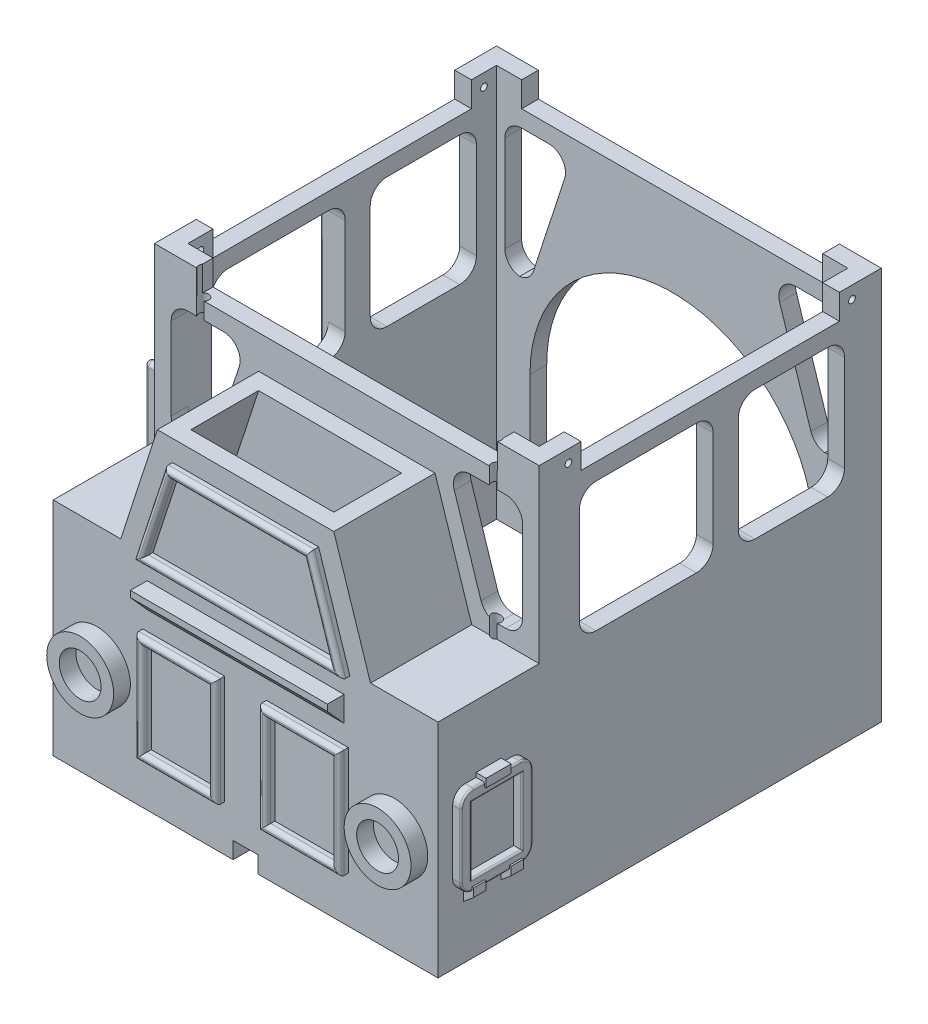
from build123d import *
from build123d.topology import SkipClean

# Parameters (mm, degrees)
SKETCH_4_W               = 46
SKETCH_4_H               = 53
SKETCH_4_W_2             = 42
SKETCH_4_H_2             = 49
EXTRUDE_1_DEPTH          = 26.5
SKETCH_5_W               = 2
SKETCH_5_H               = 2.4
SKETCH_5_H_2             = 3
SKETCH_5_H_3             = 4.8
EXTRUDE_2_DEPTH          = 17.5
SKETCH_6_W               = 12.1
SKETCH_6_H               = 2
EXTRUDE_3_DEPTH          = 44
SKETCH_8_W               = 2
SKETCH_8_H               = 2
SKETCH_8_W_2             = 41
SKETCH_8_W_3             = 1
SKETCH_8_H_2             = 34.5
SKETCH_8_H_3             = 2.4
SKETCH_8_H_4             = 36.9
SKETCH_8_W_4             = 42
EXTRUDE_4_DEPTH          = 2
EXTRUDE_9_DEPTH          = 2
EXTRUDE_10_DEPTH         = 12.1
EXTRUDE_11_DEPTH         = 2
SKETCH_12_W              = 9.778944
SKETCH_12_H              = 13
SKETCH_12_W_2            = 7.778944
SKETCH_12_H_2            = 11
EXTRUDE_1_2_DEPTH        = 1
FILLET_1_R               = 0.5
SKETCH_12_3_R            = 4
SKETCH_12_3_R_2          = 2.5
EXTRUDE_12_DEPTH         = 2
SKETCH_12_4_W            = 23.557888
SKETCH_12_4_H            = 3
EXTRUDE_13_DEPTH         = 2
CUT_EXTRUDE_1_DEPTH      = 63.911247
CUT_EXTRUDE_1_DEPTH_BACK = 63.911247
EXTRUDE_START            = -12.1
EXTRUDE_14_DEPTH         = 2
EXTRUDE_15_DEPTH         = 2
FILLET_2_R               = 2
SKETCH_17_R              = 17
CUT_EXTRUDE_2_DEPTH      = 2
EXTRUDE_2_2_DEPTH        = 1
FILLET_3_R               = 0.3
SKETCH_19_W              = 1
SKETCH_19_H              = 19.5
EXTRUDE_3_2_DEPTH        = 2
SKETCH_19_3_W            = 1
SKETCH_19_3_H            = 29.5
EXTRUDE_4_2_DEPTH        = 2
FILLET_4_R               = 0.5
FILLET_5_R               = 0.5
SKETCH_20_W              = 8.6
SKETCH_20_H              = 10.6
SKETCH_20_W_2            = 6
SKETCH_20_H_2            = 8
EXTRUDE_16_DEPTH         = 1
EXTRUDE_START_2          = -46
SKETCH_20_4_W            = 8.6
SKETCH_20_4_H            = 10.6
SKETCH_20_4_W_2          = 6
SKETCH_20_4_H_2          = 8
EXTRUDE_18_DEPTH         = 1
FILLET_6_R               = 1.5
SKETCH_20_3_W            = 3
SKETCH_20_3_H            = 1
SKETCH_20_3_W_2          = 1.5
SKETCH_20_3_H_2          = 2
EXTRUDE_17_DEPTH         = 1.2
SKETCH_20_5_W            = 3
SKETCH_20_5_H            = 1
SKETCH_20_5_W_2          = 1.5
SKETCH_20_5_H_2          = 2
EXTRUDE_19_DEPTH         = 1.2
CUT_EXTRUDE_3_DEPTH      = 68.026879
FILLET_7_R               = 0.2
SKETCH_22_W              = 2
SKETCH_22_H              = 2
SKETCH_22_W_2            = 3
SKETCH_22_H_2            = 3
EXTRUDE_20_DEPTH         = 3
SKETCH_23_R              = 0.4
CUT_EXTRUDE_4_DEPTH      = 73.450604
SKETCH_24_W              = 8
SKETCH_24_H              = 5
EXTRUDE_21_DEPTH         = 2
SKETCH_25_R              = 0.6
CUT_EXTRUDE_5_DEPTH      = 61.384187
SKETCH_26_W              = 3
SKETCH_26_H              = 2
CUT_EXTRUDE_6_DEPTH      = 2


# Some blends are built 0.0001 mm under size
with BuildPart() as part:
    # 草图4 → Extrude 1 (new body)
    with BuildSketch(Plane(origin=(0, 0, 0), x_dir=(1, 0, 0), z_dir=(0, 1, 0))):
        Rectangle(SKETCH_4_W, SKETCH_4_H)
        Rectangle(SKETCH_4_W_2, SKETCH_4_H_2, mode=Mode.SUBTRACT)
    extrude(amount=EXTRUDE_1_DEPTH)

    # 草图5 → Extrude 2 (add)
    with BuildSketch(Plane(origin=(0, 26.5, 0), x_dir=(1, 0, 0), z_dir=(0, 1, 0))):
        Polygon((-20, 26.5), (-23, 26.5), (-23, 24.5), (-21, 24.5), (-20, 24.5), align=None)
        with Locations((-22, 23.3)):
            Rectangle(SKETCH_5_W, SKETCH_5_H)
        with Locations((-22, 7.9)):
            Rectangle(SKETCH_5_W, SKETCH_5_H_2)
        with Locations((-22, -12)):
            Rectangle(SKETCH_5_W, SKETCH_5_H_3)
        with Locations((22, -12)):
            Rectangle(SKETCH_5_W, SKETCH_5_H_3)
        with Locations((22, 7.9)):
            Rectangle(SKETCH_5_W, SKETCH_5_H_2)
        with Locations((22, 23.3)):
            Rectangle(SKETCH_5_W, SKETCH_5_H)
        Polygon((23, 26.5), (20, 26.5), (20, 24.5), (21, 24.5), (23, 24.5), align=None)
    extrude(amount=EXTRUDE_2_DEPTH)

    # 草图6 → Extrude 3 (add)
    with BuildSketch(Plane.ZY.offset(23)):
        with Locations((20.45, 25.5)):
            Rectangle(SKETCH_6_W, SKETCH_6_H)
    extrude(amount=-EXTRUDE_3_DEPTH)

    # 草图8 → Extrude 4 (add)
    with BuildSketch(Plane(origin=(0, 44, 0), x_dir=(1, 0, 0), z_dir=(0, 1, 0))):
        with Locations((-22, 25.5)):
            Rectangle(SKETCH_8_W, SKETCH_8_H)
        with Locations((0.5, 25.5)):
            Rectangle(SKETCH_8_W_2, SKETCH_8_H)
        with Locations((-20.5, 25.5)):
            Rectangle(SKETCH_8_W_3, SKETCH_8_H)
        with Locations((-22, 4.85)):
            Rectangle(SKETCH_8_W, SKETCH_8_H_2)
        with Locations((-22, 23.3)):
            Rectangle(SKETCH_8_W, SKETCH_8_H_3)
        with Locations((22, 25.5)):
            Rectangle(SKETCH_8_W, SKETCH_8_H)
        with Locations((22, 6.05)):
            Rectangle(SKETCH_8_W, SKETCH_8_H_4)
        with Locations((22, -13.4)):
            Rectangle(SKETCH_8_W, SKETCH_8_H)
        with Locations((0, -13.4)):
            Rectangle(SKETCH_8_W_4, SKETCH_8_H)
        with Locations((-22, -13.4)):
            Rectangle(SKETCH_8_W, SKETCH_8_H)
    extrude(amount=-EXTRUDE_4_DEPTH)

    # 草图9 → 凸台-拉伸9 (add)
    with BuildSketch(Plane.XY.offset(14.4)):
        Polygon((12, 42), (-12, 42), (-16.5, 28.150424), (-21, 28.150424), (-21, 26.5), (-21, 24.5), (21, 24.5), (21, 26.5), (21, 28.150424), (16.5, 28.150424), align=None)
    extrude(amount=-EXTRUDE_9_DEPTH)

    # 草图10 → 凸台-拉伸10 (add)
    with BuildSketch(Plane.XY.offset(14.4)):
        Polygon((-8.546915, 40), (-10.546915, 40), (-14.933331, 26.5), (-12.933331, 26.5), align=None)
        Polygon((8.546915, 40), (10.546915, 40), (14.933331, 26.5), (12.933331, 26.5), align=None)
    extrude(amount=EXTRUDE_10_DEPTH)

    # 草图11 → 凸台-拉伸11 (add)
    with BuildSketch(Plane.XY.offset(26.5)):
        Polygon((-10.546915, 40), (10.546915, 40), (14.933331, 26.5), (-14.933331, 26.5), align=None)
    extrude(amount=-EXTRUDE_11_DEPTH)

    # 草图12 → Extrude 1 2 (add)
    # profile 1 of 3: a face of its own
    with BuildSketch(Plane.XY.offset(26.5)):
        Polygon((-8.730559, 37.5), (8.730559, 37.5), (12.467135, 26), (-12.467135, 26), align=None)
        Polygon((-8.004016, 36.5), (8.004016, 36.5), (11.090753, 27), (-11.090753, 27), align=None, mode=Mode.SUBTRACT)
    # profile 2 of 3: a face of its own
    with BuildSketch(Plane.XY.offset(26.5)):
        with Locations((-7.389472, 12)):
            Rectangle(SKETCH_12_W, SKETCH_12_H)
        with Locations((-7.389472, 12)):
            Rectangle(SKETCH_12_W_2, SKETCH_12_H_2, mode=Mode.SUBTRACT)
    # profile 3 of 3: a face of its own
    with BuildSketch(Plane.XY.offset(26.5)):
        with Locations((7.389472, 12)):
            Rectangle(SKETCH_12_W, SKETCH_12_H)
        with Locations((7.389472, 12)):
            Rectangle(SKETCH_12_W_2, SKETCH_12_H_2, mode=Mode.SUBTRACT)
    extrude(amount=EXTRUDE_1_2_DEPTH)

    # 圆角1
    fillet_1_edges = [part.edges().sort_by_distance(p)[0] for p in [
        (-7.389472, 18.5, 27.5),
        (-2.5, 12, 27.5),
        (-7.389472, 17.5, 27.5),
        (-3.5, 12, 27.5),
        (-12.278944, 12, 27.5),
        (-7.389472, 5.5, 27.5),
        (-11.278944, 12, 27.5),
        (-7.389472, 6.5, 27.5),
        (0, 26, 27.5),
        (10.598847, 31.75, 27.5),
        (0, 37.5, 27.5),
        (-10.598847, 31.75, 27.5),
        (9.547385, 31.75, 27.5),
        (0, 27, 27.5),
        (-9.547385, 31.75, 27.5),
        (0, 36.5, 27.5),
        (2.5, 12, 27.5),
        (7.389472, 5.5, 27.5),
        (7.389472, 17.5, 27.5),
        (11.278944, 12, 27.5),
        (12.278944, 12, 27.5),
        (7.389472, 18.5, 27.5),
        (3.5, 12, 27.5),
        (7.389472, 6.5, 27.5),
    ]]
    fillet(fillet_1_edges, radius=FILLET_1_R - 0.0001)  # a hair under: the kernel refuses the full size

    # 草图12<3> → 凸台-拉伸12 (add)
    # profile 1 of 2: a face of its own
    with BuildSketch(Plane.XY.offset(26.5)):
        with Locations(Location((-17.778944, 12, 0), (0, 0, 180))):
            Circle(SKETCH_12_3_R)
        with Locations((-17.778944, 12)):
            Circle(SKETCH_12_3_R_2, mode=Mode.SUBTRACT)
    # profile 2 of 2: a face of its own
    with BuildSketch(Plane.XY.offset(26.5)):
        with Locations(Location((17.778944, 12, 0), (0, 0, 180))):
            Circle(SKETCH_12_3_R)
        with Locations((17.778944, 12)):
            Circle(SKETCH_12_3_R_2, mode=Mode.SUBTRACT)
    extrude(amount=EXTRUDE_12_DEPTH)

    # 草图12<4> → 凸台-拉伸13 (add)
    with BuildSketch(Plane.XY.offset(26.5)):
        with Locations((0, 22.25)):
            Rectangle(SKETCH_12_4_W, SKETCH_12_4_H)
    extrude(amount=EXTRUDE_13_DEPTH)

    # 草图13 → 切除-拉伸1 (cut, two sides: drawn at the far end of the back side and taken through both)
    with BuildSketch(Plane.ZY.offset(11.778944).offset(-CUT_EXTRUDE_1_DEPTH_BACK)):
        Polygon((28.5, 20.75), (28.5, 23), (26.5, 20.75), align=None)
    extrude(amount=CUT_EXTRUDE_1_DEPTH + CUT_EXTRUDE_1_DEPTH_BACK, mode=Mode.SUBTRACT)

    # 草图15 → 凸台-拉伸14 (add)
    with BuildSketch(Plane.XY.offset(26.5).offset(EXTRUDE_START)):
        Polygon((-10.546915, 40), (-14.933331, 26.5), (14.933331, 26.5), (10.546915, 40), align=None)
    extrude(amount=EXTRUDE_14_DEPTH)

    # 草图16 → 凸台-拉伸15 (add)
    with BuildSketch(Plane.XY.offset(-24.5)):
        Polygon((-11.350161, 44), (-17.036255, 26.5), (17.036255, 26.5), (11.350161, 44), align=None)
    extrude(amount=-EXTRUDE_15_DEPTH)

    # 圆角2
    # the kernel refuses this fillet: 2 mm, written as the material it adds along each edge
    with BuildSketch(Plane(origin=(20, 26.5, -26.5), x_dir=(0, 1, 0), z_dir=(0, 0, 1)), Plane(origin=(21, 42, 12.4), x_dir=(-1, 0, 0), z_dir=(0, 0, 1)), Plane(origin=(23, 42, 9.6), x_dir=(0, 0, -1), z_dir=(-1, 0, 0)), Plane(origin=(-23, 42, -22.1), x_dir=(0, 0, 1), z_dir=(1, 0, 0)), Plane(origin=(-23, 42, -6.4), x_dir=(0, 0, 1), z_dir=(1, 0, 0)), Plane(origin=(23, 42, -9.4), x_dir=(0, 0, -1), z_dir=(-1, 0, 0)), Plane(origin=(21, 28.150424, 14.4), x_dir=(-1, 0, 0), z_dir=(0, 0, -1)), Plane(origin=(-20, 26.5, -24.5), x_dir=(0, 1, 0), z_dir=(0, 0, -1))) as fillet_2_piece_1:
        with BuildLine():
            CenterArc((FILLET_2_R, FILLET_2_R), FILLET_2_R, 180, 90)
            Line((0, FILLET_2_R), (0, 0))
            Line((0, 0), (FILLET_2_R, 0))
        make_face()
    extrude(amount=2)
    with BuildSketch(Plane(origin=(21, 26.5, -22.1), x_dir=(0, 0, 1), z_dir=(1, 0, 0)), Plane(origin=(20, 42, -26.5), x_dir=(0, -1, 0), z_dir=(0, 0, 1)), Plane(origin=(-21, 42, 14.4), x_dir=(0, -1, 0), z_dir=(0, 0, -1)), Plane(origin=(-21, 42, 9.6), x_dir=(0, -1, 0), z_dir=(-1, 0, 0)), Plane(origin=(-20, 42, -24.5), x_dir=(0, -1, 0), z_dir=(0, 0, -1)), Plane(origin=(-21, 42, -9.4), x_dir=(0, -1, 0), z_dir=(-1, 0, 0)), Plane(origin=(21, 42, -6.4), x_dir=(0, -1, 0), z_dir=(1, 0, 0)), Plane(origin=(21, 42, -22.1), x_dir=(0, -1, 0), z_dir=(1, 0, 0)), Plane(origin=(-21, 28.150424, 14.4), x_dir=(1, 0, 0), z_dir=(0, 0, -1)), Plane(origin=(-23, 26.5, -22.1), x_dir=(0, 0, 1), z_dir=(1, 0, 0)), Plane(origin=(-23, 26.5, -6.4), x_dir=(0, 0, 1), z_dir=(1, 0, 0)), Plane(origin=(-21, 26.5, -9.4), x_dir=(0, 0, -1), z_dir=(-1, 0, 0)), Plane(origin=(-21, 26.5, 9.6), x_dir=(0, 0, -1), z_dir=(-1, 0, 0)), Plane(origin=(23, 26.5, 9.6), x_dir=(0, 0, -1), z_dir=(-1, 0, 0)), Plane(origin=(21, 26.5, -6.4), x_dir=(0, 0, 1), z_dir=(1, 0, 0)), Plane(origin=(23, 26.5, -9.4), x_dir=(0, 0, -1), z_dir=(-1, 0, 0))) as fillet_2_piece_2:
        with BuildLine():
            CenterArc((FILLET_2_R, -FILLET_2_R), FILLET_2_R, 90, 90)
            Line((0, -FILLET_2_R), (0, 0))
            Line((0, 0), (FILLET_2_R, 0))
        make_face()
    extrude(amount=2)
    with BuildSketch(Plane(origin=(-16.5, 28.150424, 14.4), x_dir=(0.30901699437494756, 0.9510565162951535, 0), z_dir=(0, 0, -1)), Plane(origin=(16.5, 28.150424, 14.4), x_dir=(1, 0, 0), z_dir=(0, 0, -1)), Plane(origin=(-17.036255, 26.5, -24.5), x_dir=(0.3090169943749497, 0.9510565162951528, 0), z_dir=(0, 0, -1)), Plane(origin=(17.036255, 26.5, -24.5), x_dir=(1, 0, 0), z_dir=(0, 0, -1))) as fillet_2_piece_3:
        with BuildLine():
            CenterArc((FILLET_2_R * 0.726542528005, -FILLET_2_R), FILLET_2_R, 90, 72)
            Line((-FILLET_2_R * 0.22451398829, -FILLET_2_R * 0.690983005625), (0, 0))
            Line((0, 0), (FILLET_2_R * 0.726542528005, 0))
        make_face()
    extrude(amount=2)
    with BuildSketch(Plane(origin=(-12, 42, 14.4), x_dir=(-0.309016994374948, -0.9510565162951534, 0), z_dir=(0, 0, -1)), Plane(origin=(-12, 42, -26.5), x_dir=(-1, 0, 0), z_dir=(0, 0, 1))) as fillet_2_piece_4:
        with BuildLine():
            CenterArc((FILLET_2_R * 1.37638192047, FILLET_2_R), FILLET_2_R, 162, 108)
            Line((FILLET_2_R * 0.425325404176, FILLET_2_R * 1.30901699437), (0, 0))
            Line((0, 0), (FILLET_2_R * 1.37638192047, 0))
        make_face()
    extrude(amount=2)
    with BuildSketch(Plane(origin=(12, 42, 14.4), x_dir=(0.3090169943749482, -0.9510565162951532, 0), z_dir=(0, 0, -1)), Plane(origin=(12, 42, -24.5), x_dir=(0.30901699437494684, -0.9510565162951536, 0), z_dir=(0, 0, -1))) as fillet_2_piece_5:
        with BuildLine():
            CenterArc((FILLET_2_R * 1.37638192047, -FILLET_2_R), FILLET_2_R, 90, 108)
            Line((FILLET_2_R * 0.425325404176, -FILLET_2_R * 1.30901699437), (0, 0))
            Line((0, 0), (FILLET_2_R * 1.37638192047, 0))
        make_face()
    extrude(amount=2)

    # 草图17 → 切除-拉伸2 (cut)
    with BuildSketch(Plane(origin=(0, 0, -26.5), x_dir=(-1, 0, 0), z_dir=(0, 0, -1))):
        with BuildLine():
            ThreePointArc((0, 0), (-12.020815, 4.979185), (-17, 17))
            Line((-17, 17), (-17, 0))
            Line((-17, 0), (0, 0))
        make_face()
        with Locations((0, 17)):
            Circle(SKETCH_17_R)
        with BuildLine():
            Line((17, 0), (17, 17))
            ThreePointArc((17, 17), (12.020815, 4.979185), (0, 0))
            Line((0, 0), (17, 0))
        make_face()
    extrude(amount=-CUT_EXTRUDE_2_DEPTH, mode=Mode.SUBTRACT)

    # 草图18 → Extrude 2 2 (add)
    with SkipClean():  # the faces are left unmerged after this step: merging them gives an invalid solid
        with BuildSketch(Plane.ZY.offset(23)):
            with BuildLine():
                Line((10.6, 7), (10.6, 40))
                ThreePointArc((10.6, 40), (9.72132, 42.12132), (7.6, 43))
                Line((7.6, 43), (-4.4, 43))
                ThreePointArc((-4.4, 43), (-6.52132, 42.12132), (-7.4, 40))
                Line((-7.4, 40), (-7.4, 7))
                ThreePointArc((-7.4, 7), (-6.52132, 4.87868), (-4.4, 4))
                Line((-4.4, 4), (7.6, 4))
                ThreePointArc((7.6, 4), (9.72132, 4.87868), (10.6, 7))
            make_face()
            with BuildLine():
                Line((9.6, 7), (9.6, 40))
                ThreePointArc((9.6, 40), (9.014214, 41.414214), (7.6, 42))
                Line((7.6, 42), (-4.4, 42))
                ThreePointArc((-4.4, 42), (-5.814214, 41.414214), (-6.4, 40))
                Line((-6.4, 40), (-6.4, 7))
                ThreePointArc((-6.4, 7), (-5.814214, 5.585786), (-4.4, 5))
                Line((-4.4, 5), (7.6, 5))
                ThreePointArc((7.6, 5), (9.014214, 5.585786), (9.6, 7))
            make_face(mode=Mode.SUBTRACT)
        extrude(amount=EXTRUDE_2_2_DEPTH)

    # 圆角3
    fillet_3_edges = [part.edges().sort_by_distance(p)[0] for p in [
        (-24, 42.12132, -6.52132),
        (-24, 4.87868, -6.52132),
        (-24, 4.87868, 9.72132),
        (-24, 41.414214, -5.814214),
        (-24, 5.585786, 9.014214),
        (-24, 5.585786, -5.814214),
        (-24, 23.5, -7.4),
        (-24, 4, 1.6),
        (-24, 23.5, 10.6),
        (-24, 42.12132, 9.72132),
        (-24, 43, 1.6),
        (-24, 23.5, -6.4),
        (-24, 5, 1.6),
        (-24, 23.5, 9.6),
        (-24, 41.414214, 9.014214),
        (-24, 42, 1.6),
    ]]
    fillet(fillet_3_edges, radius=FILLET_3_R)

    # 草图19 → Extrude 3 2 (add)
    with SkipClean():  # the faces are left unmerged after this step: merging them gives an invalid solid
        with BuildSketch(Plane.ZY.offset(23)):
            with Locations((-9.9, 13.75)):
                Rectangle(SKETCH_19_W, SKETCH_19_H)
        extrude(amount=EXTRUDE_3_2_DEPTH)

    # 草图19<3> → Extrude 4 2 (add)
    with SkipClean():  # the faces are left unmerged after this step: merging them gives an invalid solid
        with BuildSketch(Plane.ZY.offset(23)):
            with Locations((13.1, 18.75)):
                Rectangle(SKETCH_19_3_W, SKETCH_19_3_H)
        extrude(amount=EXTRUDE_4_2_DEPTH)

    # 圆角4
    fillet_4_edges = [part.edges().sort_by_distance(p)[0] for p in [
        (-25, 18.75, 13.6),
        (-25, 18.75, 12.6),
        (-25, 13.75, -9.4),
        (-25, 13.75, -10.4),
    ]]
    fillet(fillet_4_edges, radius=FILLET_4_R - 0.0001)  # a hair under: the kernel refuses the full size

    # 圆角5
    fillet_5_edges = [part.edges().sort_by_distance(p)[0] for p in [
        (-23.75005, 33.5, 13.6),
        (-24.853583, 33.5, 13.453583),
        (-24.853583, 33.5, 12.746417),
        (-23.75005, 23.5, -9.4),
        (-24.853583, 23.5, -9.546417),
        (-24.853583, 23.5, -10.253583),
        (-23.75005, 4, 13.6),
        (-24.853583, 4, 13.453583),
        (-24.853583, 4, 12.746417),
        (-23.75005, 4, -9.4),
        (-24.853583, 4, -9.546417),
        (-24.853583, 4, -10.253583),
        (-23.75005, 33.5, 12.6),
        (-23.75005, 23.5, -10.4),
        (-23.75005, 4, 12.6),
        (-23.75005, 4, -10.4),
    ]]
    fillet(fillet_5_edges, radius=FILLET_5_R - 0.0001)  # a hair under: the kernel refuses the full size

    # 草图20 → 凸台-拉伸16 (add)
    with BuildSketch(Plane.ZY.offset(23)):
        with Locations((20.45, 13.2)):
            Rectangle(SKETCH_20_W, SKETCH_20_H)
        with Locations((20.45, 13.2)):
            Rectangle(SKETCH_20_W_2, SKETCH_20_H_2, mode=Mode.SUBTRACT)
    extrude(amount=EXTRUDE_16_DEPTH)

    # 草图20<4> → 凸台-拉伸18 (add)
    with BuildSketch(Plane.ZY.offset(23).offset(EXTRUDE_START_2)):
        with Locations((20.45, 13.2)):
            Rectangle(SKETCH_20_4_W, SKETCH_20_4_H)
        with Locations((20.45, 13.2)):
            Rectangle(SKETCH_20_4_W_2, SKETCH_20_4_H_2, mode=Mode.SUBTRACT)
    extrude(amount=-EXTRUDE_18_DEPTH)

    # 圆角6
    fillet_6_edges = [part.edges().sort_by_distance(p)[0] for p in [
        (-23.5, 18.5, 16.15),
        (-23.5, 7.9, 16.15),
        (-23.5, 7.9, 24.75),
        (-23.5, 18.5, 24.75),
        (23.5, 7.9, 24.75),
        (23.5, 7.9, 16.15),
        (23.5, 18.5, 16.15),
        (23.5, 18.5, 24.75),
    ]]
    fillet(fillet_6_edges, radius=FILLET_6_R)

    # 草图20<3> → 凸台-拉伸17 (add)
    with BuildSketch(Plane.ZY.offset(23)):
        with Locations((20.45, 18.5)):
            Rectangle(SKETCH_20_3_W, SKETCH_20_3_H)
        with Locations((18.2, 7.4)):
            Rectangle(SKETCH_20_3_W_2, SKETCH_20_3_H_2)
        with Locations((22.7, 7.4)):
            Rectangle(SKETCH_20_3_W_2, SKETCH_20_3_H_2)
    extrude(amount=EXTRUDE_17_DEPTH)

    # 草图20<5> → 凸台-拉伸19 (add)
    with BuildSketch(Plane.ZY.offset(23).offset(EXTRUDE_START_2)):
        with Locations((20.45, 18.5)):
            Rectangle(SKETCH_20_5_W, SKETCH_20_5_H)
        with Locations((18.2, 7.4)):
            Rectangle(SKETCH_20_5_W_2, SKETCH_20_5_H_2)
        with Locations((22.7, 7.4)):
            Rectangle(SKETCH_20_5_W_2, SKETCH_20_5_H_2)
    extrude(amount=-EXTRUDE_19_DEPTH)

    # 草图21 → 切除-拉伸3 (cut, through all)
    with BuildSketch(Plane(origin=(0, 0, 17.45), x_dir=(-1, 0, 0), z_dir=(0, 0, -1))):
        Polygon((24.2, 7.4), (23, 6.4), (24.2, 6.4), align=None)
        Polygon((-23, 6.4), (-24.2, 7.4), (-24.2, 6.4), align=None)
    extrude(amount=-CUT_EXTRUDE_3_DEPTH, mode=Mode.SUBTRACT)

    # 圆角7
    fillet_7_edges = [part.edges().sort_by_distance(p)[0] for p in [
        (-24, 18.5, 22.6),
        (-24, 18.06066, 24.31066),
        (-24, 8.412579, 24.379159),
        (-24, 18.5, 18.3),
        (-24, 18.06066, 16.58934),
        (-24, 8.412579, 16.520841),
        (-24, 13.2, 23.45),
        (-24, 7.9, 20.45),
        (-24, 9.2, 20.45),
        (-24, 13.2, 17.45),
        (-24, 17.2, 20.45),
        (-24, 13.2, 24.75),
        (-24, 13.2, 16.15),
        (24, 18.5, 18.3),
        (24, 18.06066, 16.58934),
        (24, 8.412579, 16.520841),
        (24, 18.5, 22.6),
        (24, 18.06066, 24.31066),
        (24, 8.412579, 24.379159),
        (24, 9.2, 20.45),
        (24, 13.2, 17.45),
        (24, 13.2, 23.45),
        (24, 17.2, 20.45),
        (24, 13.2, 16.15),
        (24, 7.9, 20.45),
        (24, 13.2, 24.75),
    ]]
    fillet(fillet_7_edges, radius=FILLET_7_R)

    # 草图22 → 凸台-拉伸20 (add)
    with BuildSketch(Plane(origin=(0, 44, 0), x_dir=(1, 0, 0), z_dir=(0, 1, 0))):
        with Locations((-22, 25.5)):
            Rectangle(SKETCH_22_W, SKETCH_22_H)
        with Locations((-19.5, 25.5)):
            Rectangle(SKETCH_22_W_2, SKETCH_22_H)
        with Locations((-22, 23)):
            Rectangle(SKETCH_22_W, SKETCH_22_H_2)
        with Locations((-22, -13.4)):
            Rectangle(SKETCH_22_W, SKETCH_22_H)
        with Locations((-19.5, -13.4)):
            Rectangle(SKETCH_22_W_2, SKETCH_22_H)
        with Locations((-22, -10.9)):
            Rectangle(SKETCH_22_W, SKETCH_22_H_2)
        with Locations((22, -13.4)):
            Rectangle(SKETCH_22_W, SKETCH_22_H)
        with Locations((19.5, -13.4)):
            Rectangle(SKETCH_22_W_2, SKETCH_22_H)
        with Locations((22, -10.9)):
            Rectangle(SKETCH_22_W, SKETCH_22_H_2)
        with Locations((22, 25.5)):
            Rectangle(SKETCH_22_W, SKETCH_22_H)
        with Locations((19.5, 25.5)):
            Rectangle(SKETCH_22_W_2, SKETCH_22_H)
        with Locations((22, 23)):
            Rectangle(SKETCH_22_W, SKETCH_22_H_2)
    extrude(amount=EXTRUDE_20_DEPTH)

    # 草图23 → 切除-拉伸4 (cut, through all)
    with BuildSketch(Plane.ZY.offset(23)):
        with Locations((-23, 45.5)):
            Circle(SKETCH_23_R)
        with Locations((10.9, 45.5)):
            Circle(SKETCH_23_R)
    extrude(amount=-CUT_EXTRUDE_4_DEPTH, mode=Mode.SUBTRACT)

    # 草图24 → 凸台-拉伸21 (add)
    with BuildSketch(Plane.XZ):
        with Locations((-19, 14)):
            Rectangle(SKETCH_24_W, SKETCH_24_H)
        with Locations((-19, -14)):
            Rectangle(SKETCH_24_W, SKETCH_24_H)
        with Locations((19, 14)):
            Rectangle(SKETCH_24_W, SKETCH_24_H)
        with Locations((19, -14)):
            Rectangle(SKETCH_24_W, SKETCH_24_H)
    extrude(amount=-EXTRUDE_21_DEPTH)

    # 草图25 → 切除-拉伸5 (cut, through all)
    with BuildSketch(Plane.XZ):
        with Locations(Location((-17.5, 14, 0), (0, 0, 270))):
            Circle(SKETCH_25_R)
        with Locations(Location((-17.5, -14, 0), (0, 0, 270))):
            Circle(SKETCH_25_R)
        with Locations(Location((17.5, -14, 0), (0, 0, 270))):
            Circle(SKETCH_25_R)
        with Locations(Location((17.5, 14, 0), (0, 0, 270))):
            Circle(SKETCH_25_R)
    extrude(amount=-CUT_EXTRUDE_5_DEPTH, mode=Mode.SUBTRACT)

    # 草图26 → 切除-拉伸6 (cut)
    with BuildSketch(Plane.XY.offset(26.5)):
        with Locations((0, 1)):
            Rectangle(SKETCH_26_W, SKETCH_26_H)
    extrude(amount=-CUT_EXTRUDE_6_DEPTH, mode=Mode.SUBTRACT)


solid = part.part
